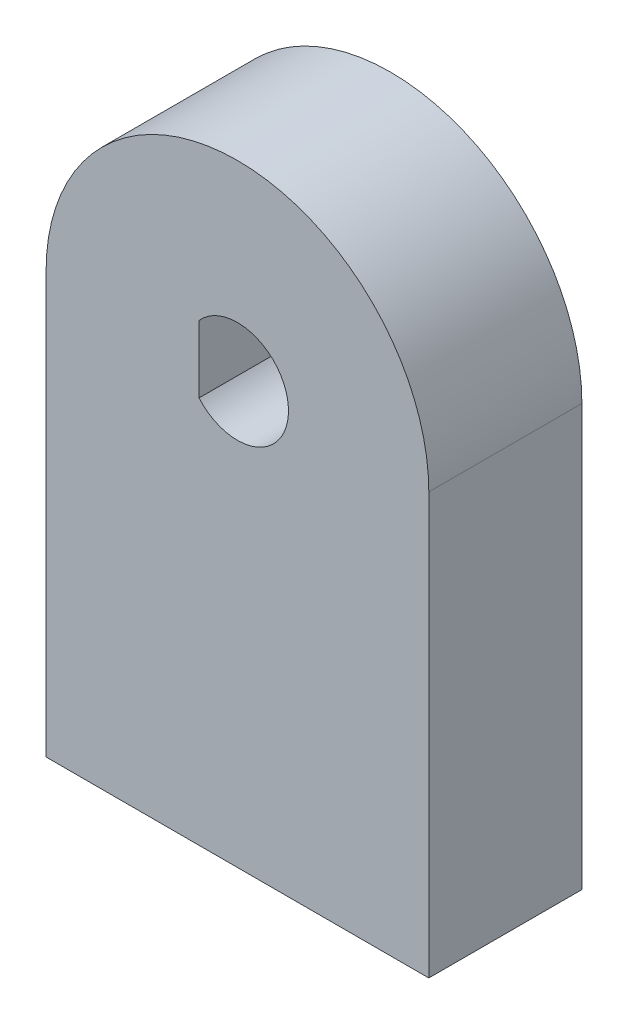
from build123d import *

# Parameters (mm, degrees)
SKETCH2_R           = 15
SKETCH2_R_2         = 11
BOSS_EXTRUDE1_DEPTH = 4
SKETCH3_R           = 15
SKETCH3_R_2         = 4
BOSS_EXTRUDE2_DEPTH = 8
BOSS_EXTRUDE5_START = -12
BOSS_EXTRUDE5_DEPTH = 12
BOSS_EXTRUDE7_START = -8
BOSS_EXTRUDE7_DEPTH = 8


with BuildPart() as part:
    # Sketch2 → Boss-Extrude1 (new body)
    with BuildSketch(Plane.XY):
        Circle(SKETCH2_R)
        Circle(SKETCH2_R_2, mode=Mode.SUBTRACT)
    extrude(amount=BOSS_EXTRUDE1_DEPTH)

    # Sketch3 → Boss-Extrude2 (add)
    with BuildSketch(Plane.XY.offset(4)):
        Circle(SKETCH3_R)
        Circle(SKETCH3_R_2, mode=Mode.SUBTRACT)
    extrude(amount=BOSS_EXTRUDE2_DEPTH)

    # Sketch6 → Boss-Extrude5 (add)
    with BuildSketch(Plane.XY.offset(12).offset(BOSS_EXTRUDE5_START)):
        with BuildLine():
            Line((-15, 0), (-15, -33))
            Line((-15, -33), (15, -33))
            Line((15, -33), (15, 0))
            ThreePointArc((15, 0), (0, -15), (-15, 0))
        make_face()
    extrude(amount=BOSS_EXTRUDE5_DEPTH)

    # Sketch8 → Boss-Extrude7 (add)
    with BuildSketch(Plane.XY.offset(12).offset(BOSS_EXTRUDE7_START)):
        with BuildLine():
            Line((-3.013818176, 2.63), (-3.013818176, -2.63))
            ThreePointArc((-3.013818176, -2.63), (-4, 0), (-3.013818176, 2.63))
        make_face()
    extrude(amount=BOSS_EXTRUDE7_DEPTH)


solid = part.part
